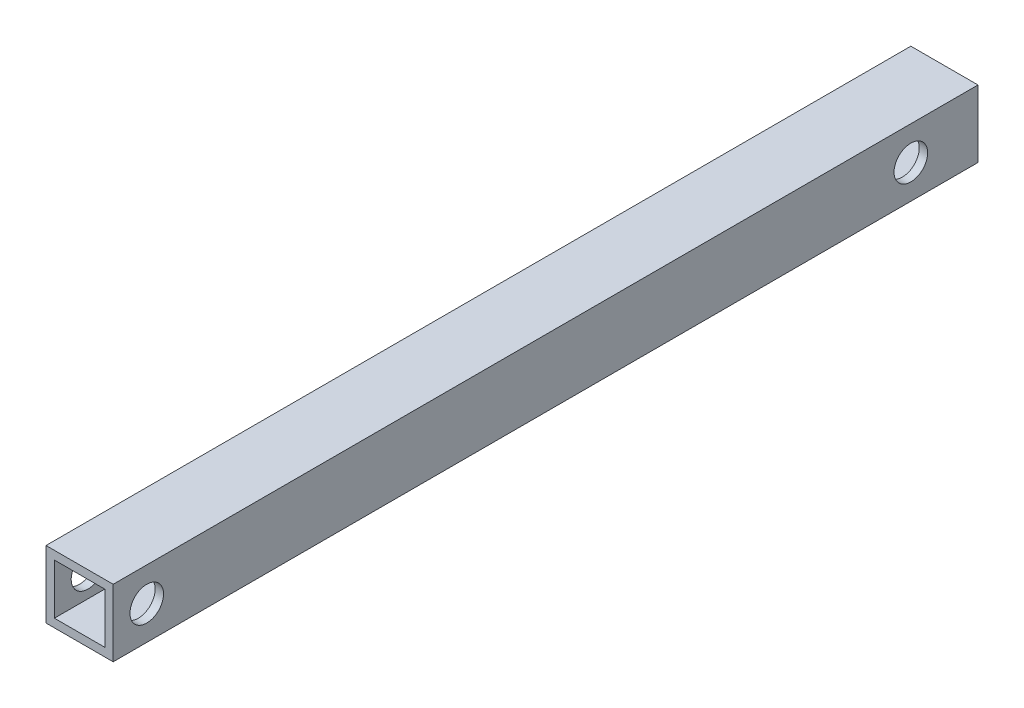
from build123d import *

# Parameters (mm, degrees)
SKETCH1_W           = 25.4
SKETCH1_H           = 25.4
SKETCH1_W_2         = 19.05
SKETCH1_H_2         = 19.05
BOSS_EXTRUDE1_DEPTH = 327.025
SKETCH5_R           = 6.35
CUT_EXTRUDE4_DEPTH  = 329.991900546


with BuildPart() as part:
    # Sketch1 → Boss-Extrude1 (new body)
    with BuildSketch(Plane.XY):
        with Locations((-12.7, 12.7)):
            Rectangle(SKETCH1_W, SKETCH1_H)
        with Locations((-12.7, 12.7)):
            Rectangle(SKETCH1_W_2, SKETCH1_H_2, mode=Mode.SUBTRACT)
    extrude(amount=BOSS_EXTRUDE1_DEPTH)

    # Sketch5 → Cut-Extrude4 (cut, through all)
    with BuildSketch(Plane(origin=(0, 0, 0), x_dir=(0, 0, -1), z_dir=(1, 0, 0))):
        with Locations((-25.4, 12.7)):
            Circle(SKETCH5_R)
        with Locations((-314.325, 12.7)):
            Circle(SKETCH5_R)
    extrude(amount=-CUT_EXTRUDE4_DEPTH, mode=Mode.SUBTRACT)


solid = part.part
